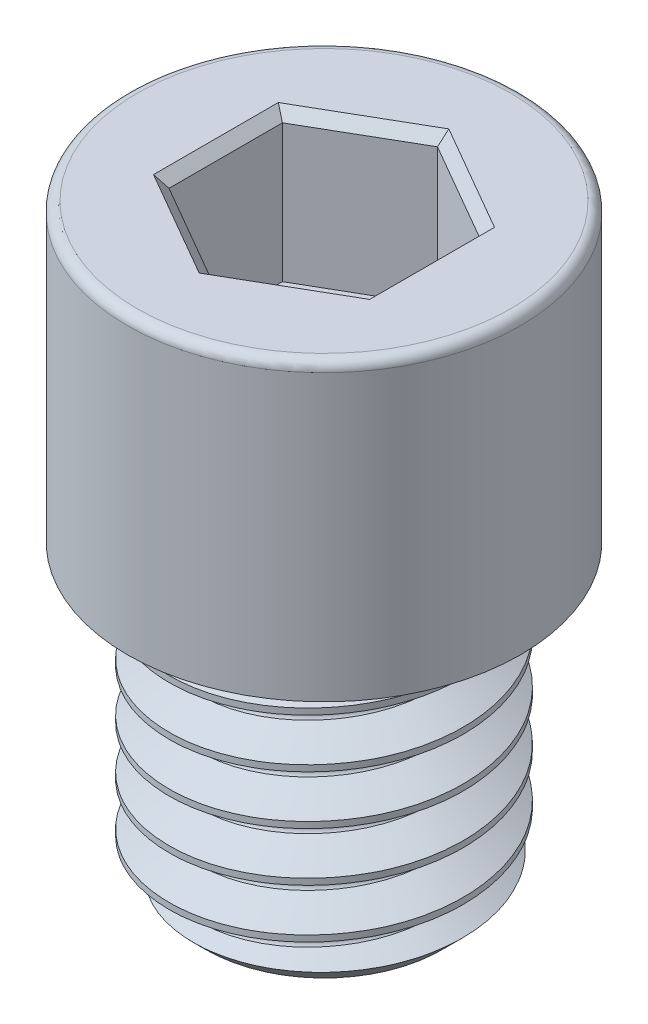
from build123d import *

# Parameters (mm, degrees)
CHAMFER1_SIZE         = 0.3
CUT_SWEEP2_PITCH      = 0.5
CUT_SWEEP2_FROM       = 0
CUT_EXTRUDE1_DEPTH    = 1.5
CHAMFER2_SIZE         = 0.1
FILLET1_R             = 0.1
BODY_MOVE_COPY1_ANGLE = 90


with BuildPart() as part:
    # Sketch1 → Revolve1 (revolve)
    with BuildSketch(Plane.XY, mode=Mode.PRIVATE) as revolve1_sk:
        Polygon((0, 0), (0, 2), (3, 2), (3, 1.5), (6, 1.5), (6, 0), align=None)
    revolve(revolve1_sk.sketch.rotate(Axis((-14.625371474, 0, 0), (1, 0, 0)), 90), axis=Axis((-14.625371474, 0, 0), (1, 0, 0)))

    # Chamfer1
    chamfer1_edges = [part.edges().sort_by_distance(p)[0] for p in [
        (6, 0, -1.5),
    ]]
    chamfer(chamfer1_edges, length=CHAMFER1_SIZE)

    # Cut-Sweep2: arcs per turn and ends read off the stored shape
    # Cut-Sweep2: the profile of Sketch5 profile screwed along a right-hand helix through 23 turns, 6 arcs to a turn; built about Z, then put on its axis
    cut_sweep2_z = Axis((0, 0, 0), (0, 0, 1))
    cut_sweep2_corners = [(1.5003, 0, -0.718924122), (1.1935, 0, -0.541793059), (1.1935, 0, -0.458206941), (1.5003, 0, -0.281075878)]
    with BuildLine(mode=Mode.PRIVATE) as cut_sweep2_profile:
        Line(cut_sweep2_corners[0], cut_sweep2_corners[1])
        Line(cut_sweep2_corners[2], cut_sweep2_corners[3])
        Line(cut_sweep2_corners[3], cut_sweep2_corners[0])
        ThreePointArc((1.1935, 0, -0.541793059), (1.177360142, 0, -0.5), (1.1935, 0, -0.458206941))
    cut_sweep2_cap = Face(cut_sweep2_profile.wire())
    cut_sweep2_arcs = [((1.1935, 0, -0.541793059), (1.155562294, 0, -0.5), (1.1935, 0, -0.458206941), (1, 0.740433557711446, 1))]  # start, shoulder, end, weights
    cut_sweep2_turn_angles = [0, 30, 60, 90, 120, 150, 180, 210, 240, 270, 300, 330, 360]
    cut_sweep2_turn_weights = [1, 0.8660254037844387, 1, 0.8660254037844387, 1, 0.8660254037844387, 1, 0.8660254037844387, 1, 0.8660254037844387, 1, 0.8660254037844387, 1]
    cut_sweep2_turn_rails = [Edge.make_bspline([Vector(p[0], p[1], 0).rotate(cut_sweep2_z, cut_sweep2_turn_angles[k]) / cut_sweep2_turn_weights[k] + Vector(0, 0, p[2] + CUT_SWEEP2_PITCH * cut_sweep2_turn_angles[k] / 360) for k in range(13)], [0, 0, 0, 1, 1, 2, 2, 3, 3, 4, 4, 5, 5, 6, 6, 6], 2, cut_sweep2_turn_weights) for p in cut_sweep2_corners]
    cut_sweep2_turn_sides = [*[Face.make_surface_from_curves(cut_sweep2_turn_rails[p[0]], cut_sweep2_turn_rails[p[1]]) for p in [(0, 1), (2, 3), (3, 0)]], *[Face.make_bezier_surface([[Vector(p[j][0], p[j][1], 0).rotate(cut_sweep2_z, cut_sweep2_turn_angles[2 * i + k]) / cut_sweep2_turn_weights[2 * i + k] + Vector(0, 0, p[j][2] + CUT_SWEEP2_PITCH * cut_sweep2_turn_angles[2 * i + k] / 360) for k in range(3)] for j in range(3)], [[p[3][j] * cut_sweep2_turn_weights[2 * i + k] for k in range(3)] for j in range(3)]) for p in cut_sweep2_arcs for i in range(6)]]
    cut_sweep2 = Plane(origin=(3, 0, 0), x_dir=(0, 0, -1), z_dir=(1, 0, 0)) * split(Solid(Shell([*[p.moved(Location((0, 0, CUT_SWEEP2_PITCH * i))) for i in range(23) for p in cut_sweep2_turn_sides], cut_sweep2_cap, cut_sweep2_cap.rotate(cut_sweep2_z, 8280).moved(Location((0, 0, CUT_SWEEP2_PITCH * 8280 / 360)))])), bisect_by=Plane.XY.offset(CUT_SWEEP2_FROM), keep=Keep.TOP, mode=Mode.PRIVATE)
    add(cut_sweep2, mode=Mode.SUBTRACT)

    # Sketch6 → Cut-Extrude1 (cut)
    with BuildSketch(Plane.ZY):
        Polygon((0.577350269, 1), (-0.577350269, 1), (-1.154700538, 0), (-0.577350269, -1), (0.577350269, -1), (1.154700538, 0), align=None)
    extrude(amount=-CUT_EXTRUDE1_DEPTH, mode=Mode.SUBTRACT)

    # Chamfer2
    chamfer2_edges = [part.edges().sort_by_distance(p)[0] for p in [
        (0, 0.5000000000000001, 0.8660254037844386),
        (0, 1, 0),
        (0, 0.5, -0.8660254037844386),
        (0, -0.4999999999999999, -0.8660254037844386),
        (0, -1, 0),
        (0, -0.5, 0.8660254037844382),
    ]]
    chamfer(chamfer2_edges, length=CHAMFER2_SIZE)

    # Fillet1
    fillet1_edges = [part.edges().sort_by_distance(p)[0] for p in [
        (0, 0, -2),
    ]]
    fillet(fillet1_edges, radius=FILLET1_R)


with BuildPart() as part_1:
    # Body-Move/Copy1: moved
    add(part.part.rotate(Axis((6.618452008, 0, 0), (0, 0, -1)), BODY_MOVE_COPY1_ANGLE))


solid = part_1.part
